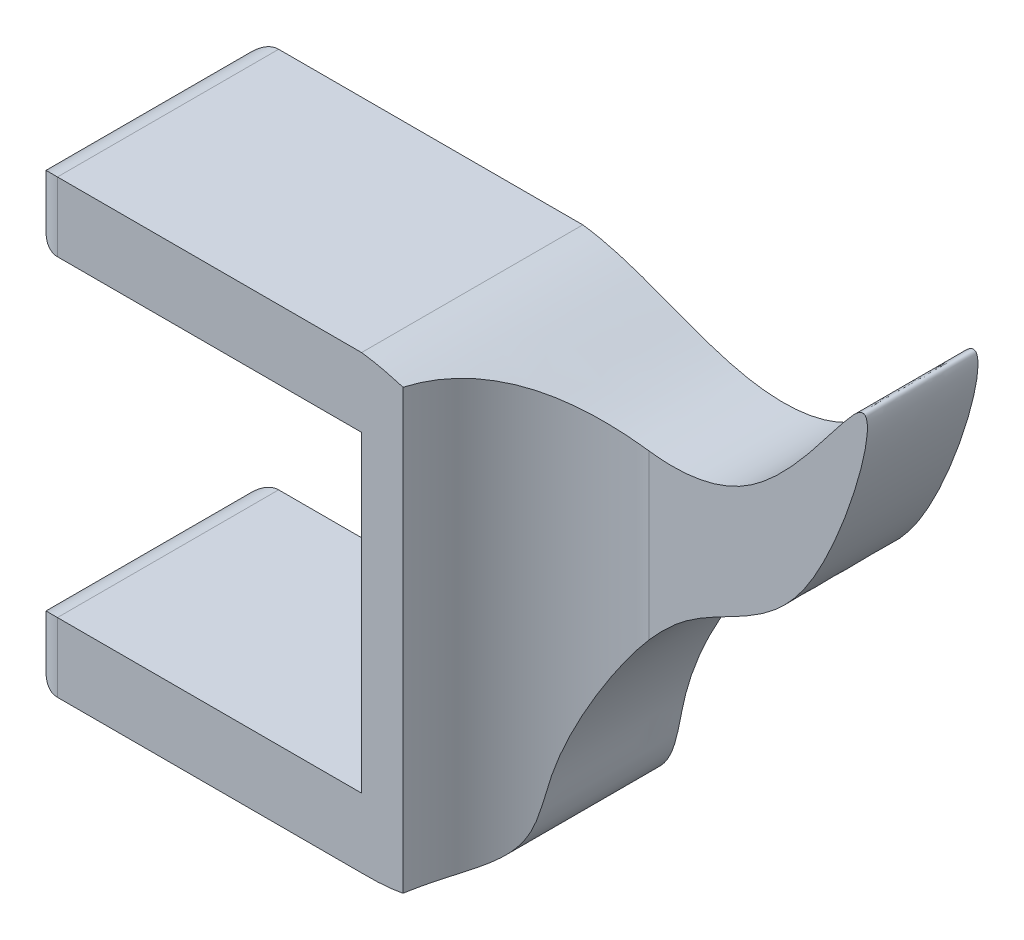
from build123d import *

# Parameters (mm, degrees)
EXTRUDE_1_DEPTH     = 8
SKETCH_3_W          = 14.026441112
SKETCH_3_H          = 4
CUT_EXTRUDE_1_DEPTH = 40
FILLET_8_R          = 1
FILLET_11_R         = 0.5
FILLET_START        = -13.686874958
FILLET_12_DEPTH     = 15.851101219
FILLET_START_2      = 4
FILLET_12_2_DEPTH   = 5


with BuildPart() as part:
    # 草图1 → 凸台-拉伸1 (new body)
    with BuildSketch(Plane.XY):
        with BuildLine():
            Line((0, 0), (12, 0))
            Line((12, 0), (12, -11.3))
            Line((12, -11.3), (0, -11.3))
            Line((0, -11.3), (0, -13.8))
            Line((0, -13.8), (12, -13.8))
            add(Edge.make_bspline(
                [(12, 2.5), (14.089162483, 2.229400973), (17.158399659, 0.30254002), (22.739763987, 0.637931928), (27.759008484, 9.334117503), (24.450058876, -2.752055458), (19.330687279, -3.088408114), (14.940540429, -10.322499022), (15.484710252, -13.85284683), (12, -13.8)],
                knots=[0, 0, 0, 0, 0.128799544, 0.211965158, 0.331337768, 0.511510634, 0.671766119, 0.852723552, 1, 1, 1, 1], degree=3))
            Line((12, 2.5), (0, 2.5))
            Line((0, 2.5), (0, 0))
        make_face()
    extrude(amount=EXTRUDE_1_DEPTH)

    # 草图3 → 切除-拉伸1 (cut)
    with BuildSketch(Plane.XZ.offset(13.8)):
        with Locations((20.513220556, 6)):
            Rectangle(SKETCH_3_W, SKETCH_3_H)
    extrude(amount=-CUT_EXTRUDE_1_DEPTH, mode=Mode.SUBTRACT)

    # 圆角8
    fillet_8_edges = [part.edges().sort_by_distance(p)[0] for p in [
        (0, 1.25, 0),
        (0, 2.5, 4),
        (0, -13.8, 4),
        (0, -11.3, 4),
        (0, 0, 4),
        (0, -12.55, 8),
        (0, 1.25, 8),
        (0, -12.55, 0),
    ]]
    fillet(fillet_8_edges, radius=FILLET_8_R)

    # 圆角11
    fillet_11_edges = [part.edges().sort_by_distance(p)[0] for p in [
        (12, -5.65, 0),
    ]]
    fillet(fillet_11_edges, radius=FILLET_11_R)

    # 圆角12: read off the stored shape, not the designer's step
    # 圆角12 outline → 圆角12 (add)
    with BuildSketch(Plane(origin=(0, 0, 0), x_dir=(1, 0, 0), z_dir=(0, 1, 0)).offset(FILLET_START)):
        with BuildLine():
            ThreePointArc((13.5, -8), (15.236701826, -5.127016654), (18.398979486, -4))
            Line((18.398979486, -4), (13.5, -4))
            Line((13.5, -4), (13.5, -8))
        make_face()
    extrude(amount=FILLET_12_DEPTH)

    # Fillet 12 2 outline → Fillet 12 2 (cut)
    with BuildSketch(Plane.XY.offset(FILLET_START_2)):
        with BuildLine():
            add(Edge.make_bspline(
                [(13.49999998, -13.686874862), (15.421167086, -13.295212611), (15.170147711, -9.944151782), (18.018222909, -5.251088974), (19.865143783, -3.942002075), (20, -3.852933376)],
                knots=[0.025548283, 0.025548283, 0.025548283, 0.025548283, 0.147276448, 0.328233881, 0.342452135, 0.342452135, 0.342452135, 0.342452135], degree=3))
            Line((13.49999998, -13.686874862), (20, -13.686874958))
            Line((20, -13.686874958), (20, -3.852933376))
        make_face()
        with BuildLine():
            add(Edge.make_bspline(
                [(20, 0.605858351), (19.332376241, 0.51622365), (17.066020332, 0.653432144), (15.013370985, 1.703532717), (13.5, 2.164226261)],
                knots=[0.830073638, 0.830073638, 0.830073638, 0.830073638, 0.871200456, 0.968469565, 0.968469565, 0.968469565, 0.968469565], degree=3))
            Line((20, 0.605858351), (20, 2.164226261))
            Line((20, 2.164226261), (13.5, 2.164226261))
        make_face()
    extrude(amount=FILLET_12_2_DEPTH, mode=Mode.SUBTRACT)


solid = part.part
